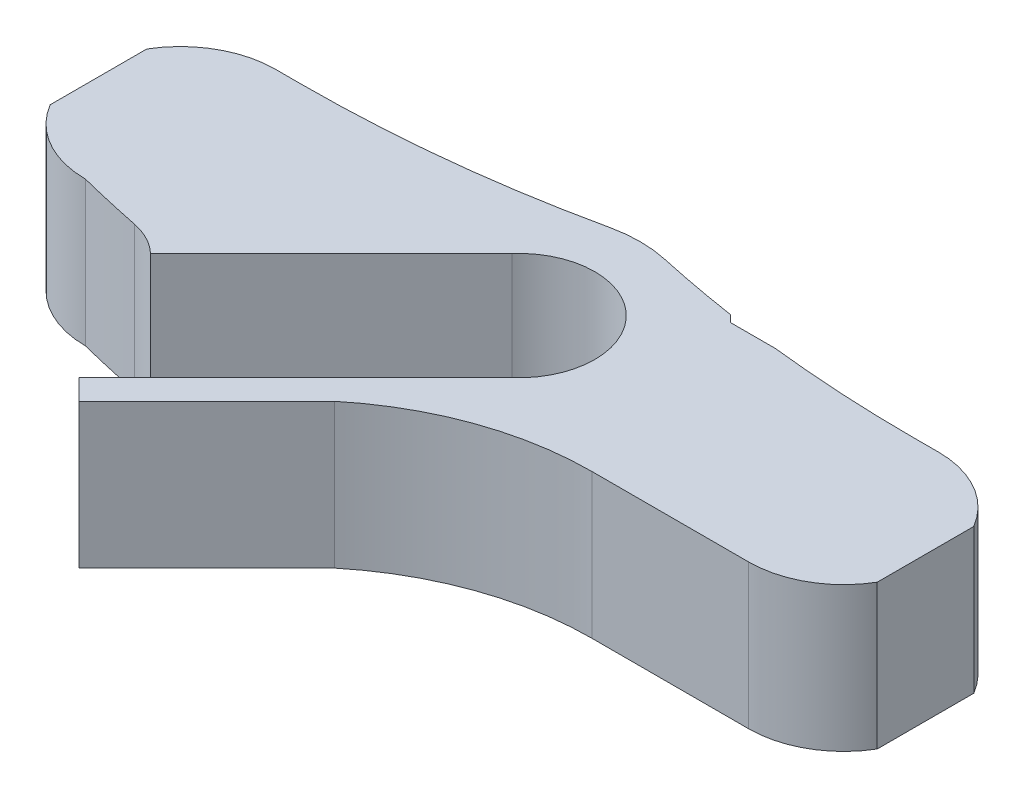
from build123d import *

# Parameters (mm, degrees)
BOSS_EXTRUDE2_DEPTH = 10.5
BOSS_EXTRUDE3_DEPTH = 10.5
FILLET1_R           = 100


with BuildPart() as part:
    # Sketch1 → Boss-Extrude2 (new body)
    with BuildSketch(Plane(origin=(0, 0, 0), x_dir=(1, 0, 0), z_dir=(0, 1, 0))):
        with BuildLine():
            Line((3.5, 3.507264218), (3.5, -3.507264218))
            ThreePointArc((3.5, -3.507264218), (6.023664299, -5.996968064), (9.45, -6.906764966))
            ThreePointArc((9.45, -6.906764966), (13.341155227, -5.869242314), (17.152471347, -7.169785158))
            ThreePointArc((17.152471347, -7.169785158), (17.367404774, -7.330790599), (17.575940883, -7.5))
            Line((17.575940883, -7.5), (18.236470068, -7.5))
            Line((18.236470068, -7.5), (29.643235034, 3.906764966))
            ThreePointArc((29.643235034, 3.906764966), (37.704252339, 4.154252339), (37.456764966, -3.906764966))
            Line((37.456764966, -3.906764966), (25.736470068, -15.627059864))
            Line((25.736470068, -15.627059864), (27.222899263, -17.113489059))
            Line((27.222899263, -17.113489059), (32.492349737, -11.844038585))
            ThreePointArc((32.492349737, -11.844038585), (38.950911947, -8.178365919), (46.267551404, -6.906764966))
            Line((46.267551404, -6.906764966), (57.65, -6.906764966))
            ThreePointArc((57.65, -6.906764966), (61.076335701, -5.996968064), (63.6, -3.507264218))
            Line((63.6, -3.507264218), (63.6, 3.507264218))
            ThreePointArc((63.6, 3.507264218), (61.076335701, 5.996968064), (57.65, 6.906764966))
            Line((57.65, 6.906764966), (55.770931212, 6.906764966))
            ThreePointArc((55.770931212, 6.906764966), (50.476561055, 7.055190286), (45.19882198, 7.5))
            Line((45.19882198, 7.5), (41.924547238, 7.5))
            Line((41.924547238, 7.5), (41.422065041, 8.002482197))
            ThreePointArc((41.422065041, 8.002482197), (38.474068809, 8.503220626), (35.543391077, 9.09697881))
            ThreePointArc((35.543391077, 9.09697881), (33.55, 9.312820811), (31.556608923, 9.09697881))
            ThreePointArc((31.556608923, 9.09697881), (21.501954522, 7.455914007), (11.329068788, 6.906764966))
            Line((11.329068788, 6.906764966), (9.45, 6.906764966))
            ThreePointArc((9.45, 6.906764966), (6.023664299, 5.996968064), (3.5, 3.507264218))
        make_face()
    extrude(amount=BOSS_EXTRUDE2_DEPTH)

    # Sketch4 → Boss-Extrude3 (add)
    with BuildSketch(Plane.XZ):
        with BuildLine():
            ThreePointArc((17.575940883, 7.5), (17.752085177, 7.65383798), (17.922940136, 7.813529932))
            Line((17.922940136, 7.813529932), (16.508443005, 9.228027063))
            ThreePointArc((16.508443005, 9.228027063), (13.612622768, 7.891439794), (10.504365982, 8.606268534))
            Line((10.504365982, 8.606268534), (9.45, 6.906764966))
            ThreePointArc((9.45, 6.906764966), (13.609320969, 5.883604236), (17.575940883, 7.5))
        make_face()
        with BuildLine():
            Line((17.575940883, 7.5), (18.236470068, 7.5))
            Line((18.236470068, 7.5), (17.922940136, 7.813529932))
            ThreePointArc((17.922940136, 7.813529932), (17.752085177, 7.65383798), (17.575940883, 7.5))
        make_face()
        Polygon((21.720364105, 19.643165827), (25.736470068, 15.627059864), (26.69888256, 16.589472356), (27.222899263, 17.113489059), (23.2067933, 21.129595022), align=None)
    extrude(amount=-BOSS_EXTRUDE3_DEPTH)

    # Fillet1
    # the kernel refuses this fillet: 100 mm, written as the material it takes off along each edge
    with BuildSketch(Plane(origin=(10.504365982, -9.09791834, 8.606268534), x_dir=(0.9842985265929657, 0, -0.17651178585838628), z_dir=(0, 1, 0))) as fillet1_piece_1:
        with BuildLine():
            CenterArc((40.530590954, 92.946344003), FILLET1_R, 245.626436409, 2.724892596)
            Line((-0.737828472, 1.85892688), (-1.563196861, 0.037178538))
            ThreePointArc((-1.563196861, 0.037178538), (-2.227841116, 0.191634968), (-1.85892688, -0.737828472))
            Line((-1.85892688, -0.737828472), (0.737828472, -1.85892688))
            ThreePointArc((0.737828472, -1.85892688), (1.819583668, -1.652094823), (2.901338864, -1.85892688))
            Line((2.901338864, -1.85892688), (3.639167336, 0))
        make_face()
    extrude(amount=28.69583668, mode=Mode.SUBTRACT)


solid = part.part
